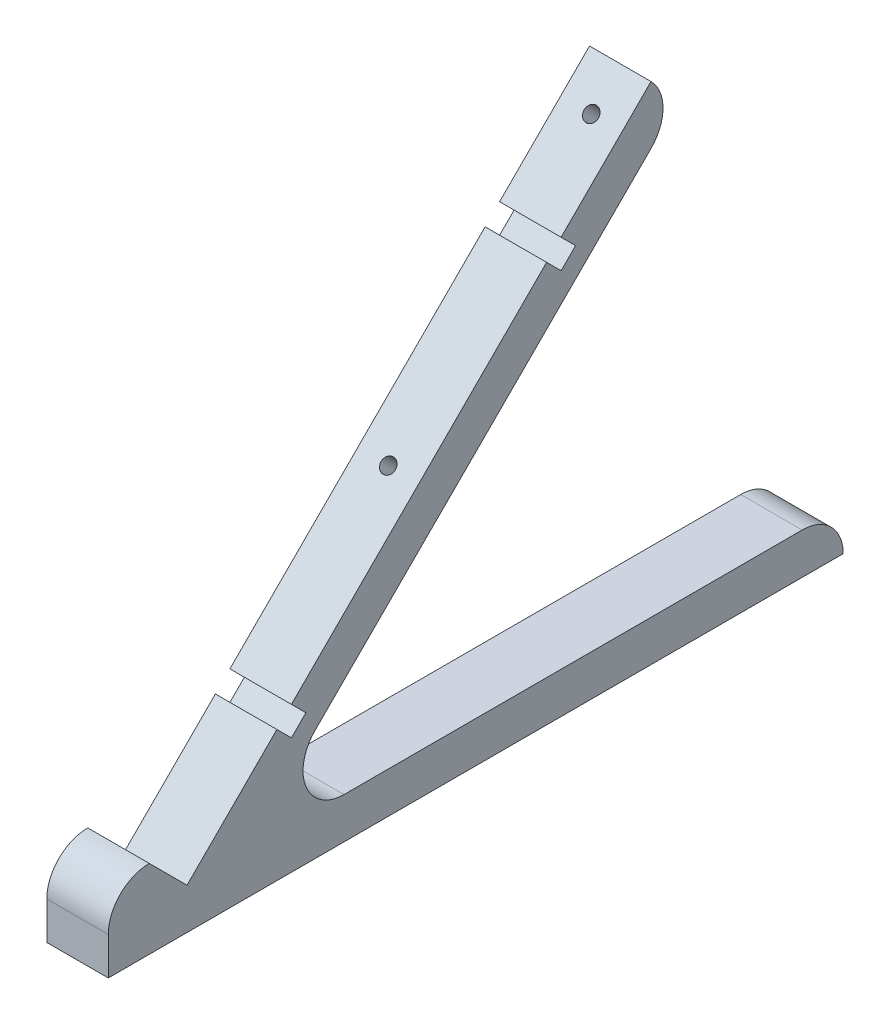
from build123d import *

# Parameters (mm, degrees)
SKETCH1_W           = 160
SKETCH1_H           = 10
SKETCH1_W_2         = 9.192388155
BOSS_EXTRUDE1_DEPTH = 15
CUT_EXTRUDE1_REACH  = 205.486
SKETCH2_R           = 3.25
SKETCH2_R_2         = 1.75
FILLET1_R           = 10
SKETCH2_3_W         = 15
SKETCH2_3_H         = 5
CUT_EXTRUDE2_DEPTH  = 5
SKETCH2_4_R         = 3.25
SKETCH2_4_R_2       = 1.75
BOSS_EXTRUDE2_DEPTH = 5


with BuildPart() as part:
    # Sketch1 → Boss-Extrude1 (new body)
    with BuildSketch(Plane(origin=(0, 0, 0), x_dir=(0, 0, -1), z_dir=(1, 0, 0))):
        Polygon((113.13708499, 123.13708499), (0, 10), (14.142135624, 10), (120.208152802, 116.066017178), align=None)
        with Locations((80, 5)):
            Rectangle(SKETCH1_W, SKETCH1_H)
        with Locations((-4.596194077, 5)):
            Rectangle(SKETCH1_W_2, SKETCH1_H)
        Polygon((0, 10), (-9.192388155, 19.192388155), (-9.192388155, 10), align=None)
        Polygon((-9.192388155, 0), (-9.192388155, 10), (-9.192388155, 19.192388155), (-19.192388155, 19.192388155), (-19.192388155, 0), align=None)
    extrude(amount=BOSS_EXTRUDE1_DEPTH)

    # Sketch2 → Cut-Extrude1 (cut, up to next)
    with BuildSketch(Plane(origin=(0, 5, 5), x_dir=(1, 0, 0), z_dir=(0, 0.7071067811865562, 0.7071067811865389)), mode=Mode.PRIVATE) as cut_extrude1_sk1:
        with Locations(Location((7.5, 157.071067812, 0), (0, 0, 270))):
            Circle(SKETCH2_R)
        with Locations((7.5, 157.071067812)):
            Circle(SKETCH2_R_2, mode=Mode.SUBTRACT)
    cut_extrude1_tool1 = extrude(cut_extrude1_sk1.sketch, amount=-CUT_EXTRUDE1_REACH, mode=Mode.PRIVATE) & part.part
    # Sketch2 → Cut-Extrude1 (cut, up to next)
    with BuildSketch(Plane(origin=(0, 5, 5), x_dir=(1, 0, 0), z_dir=(0, 0.7071067811865562, 0.7071067811865389)), mode=Mode.PRIVATE) as cut_extrude1_sk2:
        with Locations((7.5, 157.071067812)):
            Circle(SKETCH2_R_2)
    cut_extrude1_tool2 = extrude(cut_extrude1_sk2.sketch, amount=-CUT_EXTRUDE1_REACH, mode=Mode.PRIVATE) & part.part
    # Sketch2 → Cut-Extrude1 (cut, up to next)
    with BuildSketch(Plane(origin=(0, 5, 5), x_dir=(1, 0, 0), z_dir=(0, 0.7071067811865562, 0.7071067811865389)), mode=Mode.PRIVATE) as cut_extrude1_sk3:
        with Locations(Location((7.5, 87.071067812, 0), (0, 0, 270))):
            Circle(SKETCH2_R)
        with Locations((7.5, 87.071067812)):
            Circle(SKETCH2_R_2, mode=Mode.SUBTRACT)
    cut_extrude1_tool3 = extrude(cut_extrude1_sk3.sketch, amount=-CUT_EXTRUDE1_REACH, mode=Mode.PRIVATE) & part.part
    # Sketch2 → Cut-Extrude1 (cut, up to next)
    with BuildSketch(Plane(origin=(0, 5, 5), x_dir=(1, 0, 0), z_dir=(0, 0.7071067811865562, 0.7071067811865389)), mode=Mode.PRIVATE) as cut_extrude1_sk4:
        with Locations((7.5, 87.071067812)):
            Circle(SKETCH2_R_2)
    cut_extrude1_tool4 = extrude(cut_extrude1_sk4.sketch, amount=-CUT_EXTRUDE1_REACH, mode=Mode.PRIVATE) & part.part
    add(cut_extrude1_tool1.solids().sort_by_distance((7.5, 118.299114, -108.299114))[0], mode=Mode.SUBTRACT)
    add(cut_extrude1_tool2.solids().sort_by_distance((7.5, 116.066017, -106.066017))[0], mode=Mode.SUBTRACT)
    add(cut_extrude1_tool3.solids().sort_by_distance((7.5, 68.80164, -58.80164))[0], mode=Mode.SUBTRACT)
    add(cut_extrude1_tool4.solids().sort_by_distance((7.5, 66.568542, -56.568542))[0], mode=Mode.SUBTRACT)

    # Fillet1
    # the kernel refuses this fillet: 10 mm, written as the material it adds along each edge
    with BuildSketch(Plane(origin=(0, 10, -14.142135624), x_dir=(0, 0.707106781186544, -0.7071067811865511), z_dir=(1, 0, 0))) as fillet1_piece_1:
        with BuildLine():
            CenterArc((FILLET1_R * 2.41421356237, -FILLET1_R), FILLET1_R, 90, 135)
            Line((FILLET1_R * 1.70710678119, -FILLET1_R * 1.70710678119), (0, 0))
            Line((0, 0), (FILLET1_R * 2.41421356237, 0))
        make_face()
    extrude(amount=15)
    # the kernel refuses this fillet: 10 mm, written as the material it takes off along each edge
    with BuildSketch(Plane(origin=(-25, 116.066017178, -120.208152802), x_dir=(0, 0.7071067811865482, 0.7071067811865468), z_dir=(1, 0, 0))) as fillet1_2_piece_1:
        with BuildLine():
            CenterArc((FILLET1_R, FILLET1_R), FILLET1_R, 180, 90)
            Line((0, FILLET1_R), (0, 0))
            Line((0, 0), (FILLET1_R, 0))
        make_face()
    extrude(amount=65, mode=Mode.SUBTRACT)
    with BuildSketch(Plane(origin=(-25, 10, -160), x_dir=(0, -1, 0), z_dir=(1, 0, 0)), Plane(origin=(-25, 19.192388155, 19.192388155), x_dir=(0, 0, -1), z_dir=(1, 0, 0))) as fillet1_2_piece_2:
        with BuildLine():
            CenterArc((FILLET1_R, -FILLET1_R), FILLET1_R, 90, 90)
            Line((0, -FILLET1_R), (0, 0))
            Line((0, 0), (FILLET1_R, 0))
        make_face()
    extrude(amount=65, mode=Mode.SUBTRACT)

    # Sketch2<3> → Cut-Extrude2 (cut)
    with BuildSketch(Plane(origin=(0, 5, 5), x_dir=(1, 0, 0), z_dir=(0, 0.7071067811865562, 0.7071067811865389))):
        with Locations((7.5, 133.571067812)):
            Rectangle(SKETCH2_3_W, SKETCH2_3_H)
        with Locations((7.5, 40.571067812)):
            Rectangle(SKETCH2_3_W, SKETCH2_3_H)
    extrude(amount=-CUT_EXTRUDE2_DEPTH, mode=Mode.SUBTRACT)

    # Sketch2<4> → Boss-Extrude2 (add)
    # profile 1 of 2: a face of its own
    with BuildSketch(Plane(origin=(0, 5, 5), x_dir=(1, 0, 0), z_dir=(0, 0.7071067811865562, 0.7071067811865389))):
        with Locations(Location((7.5, 87.071067812, 0), (0, 0, 270))):
            Circle(SKETCH2_4_R)
        with Locations(Location((7.5, 87.071067812, 0), (0, 0, 270))):
            Circle(SKETCH2_4_R_2, mode=Mode.SUBTRACT)
    # profile 2 of 2: a face of its own
    with BuildSketch(Plane(origin=(0, 5, 5), x_dir=(1, 0, 0), z_dir=(0, 0.7071067811865562, 0.7071067811865389))):
        with Locations(Location((7.5, 157.071067812, 0), (0, 0, 270))):
            Circle(SKETCH2_4_R)
        with Locations(Location((7.5, 157.071067812, 0), (0, 0, 270))):
            Circle(SKETCH2_4_R_2, mode=Mode.SUBTRACT)
    extrude(amount=-BOSS_EXTRUDE2_DEPTH)


solid = part.part
